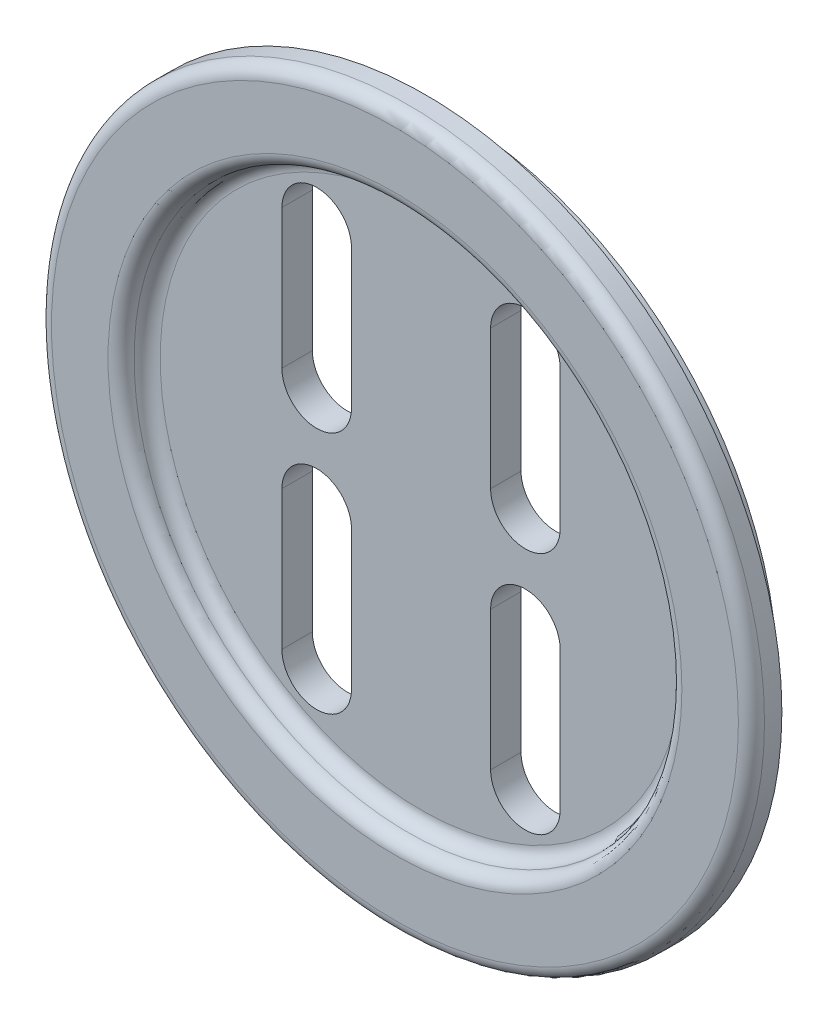
from build123d import *

# Parameters (mm, degrees)
SKETCH1_R           = 41
BOSS_EXTRUDE1_DEPTH = 3.5
SKETCH2_R           = 37.5
BOSS_EXTRUDE2_DEPTH = 3
SKETCH4_R           = 31.5
CUT_EXTRUDE3_DEPTH  = 3
CUT_EXTRUDE4_DEPTH  = 21
FILLET1_R           = 1.5


with BuildPart() as part:
    # Sketch1 → Boss-Extrude1 (new body)
    with BuildSketch(Plane.XY):
        Circle(SKETCH1_R)
    extrude(amount=BOSS_EXTRUDE1_DEPTH)

    # Sketch2 → Boss-Extrude2 (add)
    with BuildSketch(Plane.XY):
        Circle(SKETCH2_R)
    extrude(amount=-BOSS_EXTRUDE2_DEPTH)

    # Sketch4 → Cut-Extrude3 (cut)
    with BuildSketch(Plane.XY.offset(3.5)):
        Circle(SKETCH4_R)
    extrude(amount=-CUT_EXTRUDE3_DEPTH, mode=Mode.SUBTRACT)

    # Sketch5 → Cut-Extrude4 (cut)
    with BuildSketch(Plane.XY.offset(3.5)):
        with BuildLine():
            Line((-16, 22), (-16, 6))
            ThreePointArc((-16, 6), (-12, 2), (-8, 6))
            Line((-8, 6), (-8, 22))
            ThreePointArc((-8, 22), (-12, 26), (-16, 22))
        make_face()
        with BuildLine():
            Line((-8, -22), (-8, -6))
            ThreePointArc((-8, -6), (-12, -2), (-16, -6))
            Line((-16, -6), (-16, -22))
            ThreePointArc((-16, -22), (-12, -26), (-8, -22))
        make_face()
        with BuildLine():
            Line((16, -22), (16, -6))
            ThreePointArc((16, -6), (12, -2), (8, -6))
            Line((8, -6), (8, -22))
            ThreePointArc((8, -22), (12, -26), (16, -22))
        make_face()
        with BuildLine():
            Line((16, 22), (16, 6))
            ThreePointArc((16, 6), (12, 2), (8, 6))
            Line((8, 6), (8, 22))
            ThreePointArc((8, 22), (12, 26), (16, 22))
        make_face()
    extrude(amount=-CUT_EXTRUDE4_DEPTH, mode=Mode.SUBTRACT)

    # Fillet1
    fillet1_edges = [part.edges().sort_by_distance(p)[0] for p in [
        (-31.5, 0, 0.5),
        (-31.5, 0, 3.5),
        (-41, 0, 3.5),
    ]]
    fillet(fillet1_edges, radius=FILLET1_R - 0.0001)  # a hair under: the kernel refuses the full size


solid = part.part
